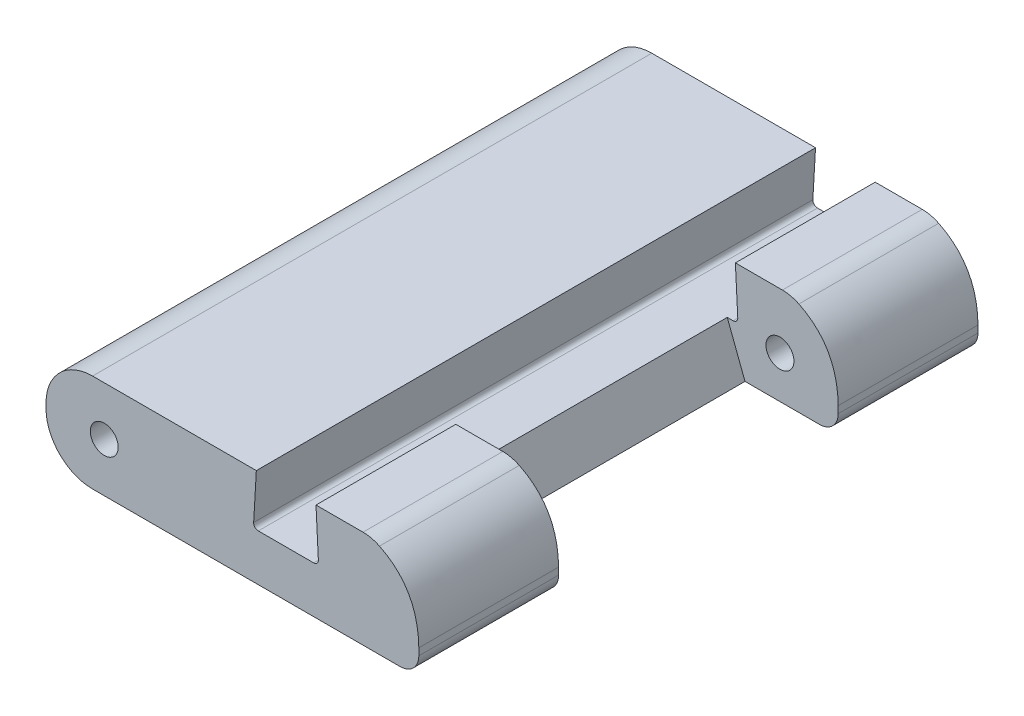
from build123d import *

# Parameters (mm, degrees)
SKETCH1_W                = 8
SKETCH1_H                = 12
BOSS_EXTRUDE1_DEPTH      = 2.1
SKETCH2_W                = 2
SKETCH2_H                = 6
CUT_EXTRUDE1_DEPTH       = 2.1
CUT_EXTRUDE4_START       = -12
CUT_EXTRUDE4_DEPTH       = 12
SKETCH4_W                = 6
SKETCH4_H                = 1.1
CUT_EXTRUDE5_DEPTH       = 0.5
CUT_EXTRUDE14_DEPTH      = 6
FILLET1_R                = 1
FILLET2_R                = 0.4
CUT_EXTRUDE15_DEPTH      = 15.574292436
CUT_EXTRUDE15_DEPTH_BACK = 15.574292436
SKETCH8_R                = 0.3
CUT_EXTRUDE16_DEPTH      = 15.574292587
SKETCH9_R                = 0.3
CUT_EXTRUDE17_DEPTH      = 10
FILLET4_R                = 0.8


# Read off the part's stored shape, not the designer's step: Cut-Extrude4
with BuildPart() as part:
    # Sketch1 → Boss-Extrude1 (new body)
    with BuildSketch(Plane(origin=(0, 0, 0), x_dir=(1, 0, 0), z_dir=(0, 1, 0))):
        with Locations((4, 6)):
            Rectangle(SKETCH1_W, SKETCH1_H)
    extrude(amount=BOSS_EXTRUDE1_DEPTH)

    # Sketch2 → Cut-Extrude1 (cut)
    with BuildSketch(Plane(origin=(0, 2.1, 0), x_dir=(1, 0, 0), z_dir=(0, 1, 0))):
        with Locations((7, 6)):
            Rectangle(SKETCH2_W, SKETCH2_H)
    extrude(amount=-CUT_EXTRUDE1_DEPTH, mode=Mode.SUBTRACT)

    # Cut-Extrude4 outline → Cut-Extrude4 (cut)
    with BuildSketch(Plane.XY.offset(CUT_EXTRUDE4_START)):
        with BuildLine():
            ThreePointArc((5.744749223, 1), (5.817245121, 1.031120796), (5.844618418, 1.105113104))
            Line((5.844618418, 1.105113104), (5.793682188, 2.1))
            Line((5.793682188, 2.1), (4.513567693, 2.1))
            Line((4.513567693, 2.1), (4.45611228, 1.105769256))
            ThreePointArc((4.45611228, 1.105769256), (4.483223902, 1.031359362), (4.555945719, 1))
            Line((4.555945719, 1), (5.744749223, 1))
        make_face()
    extrude(amount=CUT_EXTRUDE4_DEPTH, mode=Mode.SUBTRACT)

    # Sketch4 → Cut-Extrude5 (cut)
    with BuildSketch(Plane(origin=(6, 0, 0), x_dir=(0, 0, -1), z_dir=(1, 0, 0))):
        with Locations((6, 1.55)):
            Rectangle(SKETCH4_W, SKETCH4_H)
    extrude(amount=-CUT_EXTRUDE5_DEPTH, mode=Mode.SUBTRACT)

    # Sketch6 → Cut-Extrude14 (cut)
    with BuildSketch(Plane.XY.offset(-9)):
        Polygon((6, 0), (6, 1), (5.619051105, 1), align=None)
    extrude(amount=CUT_EXTRUDE14_DEPTH, mode=Mode.SUBTRACT)

    # Fillet1
    fillet1_edges = [part.edges().sort_by_distance(p)[0] for p in [
        (0, 2.1, -6),
        (0, 0, -6),
    ]]
    fillet(fillet1_edges, radius=FILLET1_R)

    # Fillet2
    fillet2_edges = [part.edges().sort_by_distance(p)[0] for p in [
        (8, 0, -10.5),
        (8, 0, -1.5),
    ]]
    fillet(fillet2_edges, radius=FILLET2_R)

    # Sketch7 → Cut-Extrude15 (cut, two sides: drawn at the far end of the back side and taken through both)
    with BuildSketch(Plane.XY.offset(-CUT_EXTRUDE15_DEPTH_BACK)):
        with BuildLine():
            Line((8, 2.1), (6.963365026, 2.1))
            add(Edge.make_bspline(
                [(6.963365026, 2.1), (7.9845252, 1.726197455), (8, 0.549529298)],
                knots=[0, 0, 0, 0.970144169, 0.970144169, 0.970144169], degree=2))
            Line((8, 0.549529298), (8, 2.1))
        make_face()
    extrude(amount=CUT_EXTRUDE15_DEPTH + CUT_EXTRUDE15_DEPTH_BACK, mode=Mode.SUBTRACT)

    # Sketch8 → Cut-Extrude16 (cut, through all)
    with BuildSketch(Plane.XY):
        with Locations((1.25, 1.05)):
            Circle(SKETCH8_R)
    extrude(amount=-CUT_EXTRUDE16_DEPTH, mode=Mode.SUBTRACT)

    # Sketch9 → Cut-Extrude17 (cut)
    with BuildSketch(Plane(origin=(0, 0, -12), x_dir=(-1, 0, 0), z_dir=(0, 0, -1))):
        with Locations((-6.75, 0.9)):
            Circle(SKETCH9_R)
    extrude(amount=-CUT_EXTRUDE17_DEPTH, mode=Mode.SUBTRACT)

    # Fillet4
    fillet4_edges = [part.edges().sort_by_distance(p)[0] for p in [
        (6.963365026, 2.1, -10.5),
        (6.963365026, 2.1, -1.5),
    ]]
    fillet(fillet4_edges, radius=FILLET4_R)


solid = part.part
